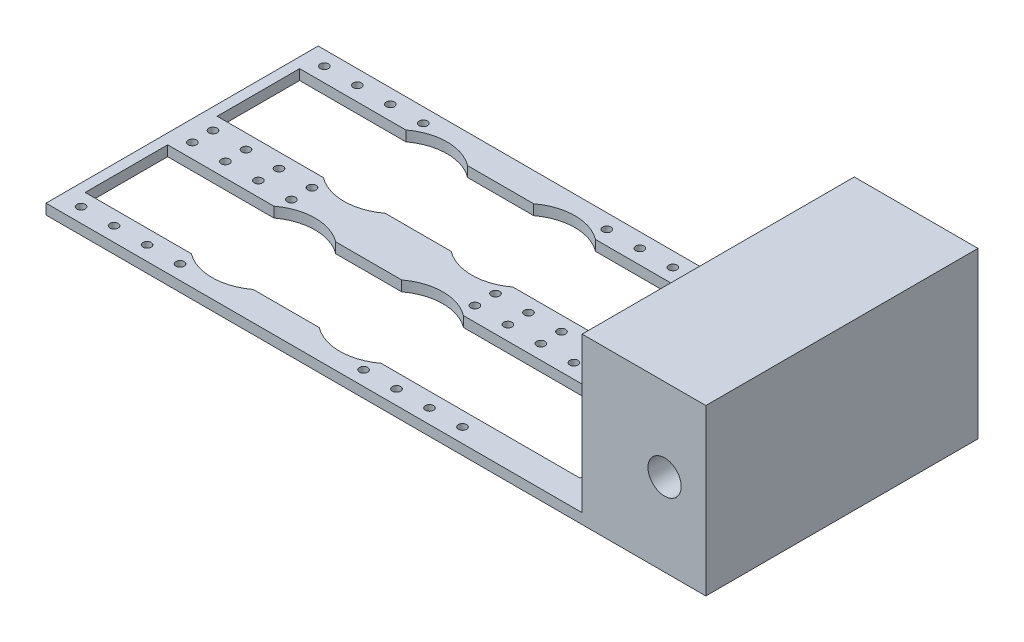
from build123d import *

# Parameters (mm, degrees)
SKETCH1_W           = 160
SKETCH1_H           = 66
BOSS_EXTRUDE1_DEPTH = 40
SKETCH2_R           = 4.025
SKETCH2_W           = 130
SKETCH2_H           = 37.5
CUT_EXTRUDE1_DEPTH  = 112.157545853
SKETCH3_R           = 1
SKETCH3_W           = 120
SKETCH3_H           = 20
CUT_EXTRUDE2_DEPTH  = 96.336247042
SKETCH4_R           = 12.5
CUT_EXTRUDE3_DEPTH  = 95.314633011


with BuildPart() as part:
    # Sketch1 → Boss-Extrude1 (new body)
    with BuildSketch(Plane(origin=(0, 0, 0), x_dir=(1, 0, 0), z_dir=(0, 1, 0))):
        Rectangle(SKETCH1_W, SKETCH1_H)
    extrude(amount=BOSS_EXTRUDE1_DEPTH)

    # Sketch2 → Cut-Extrude1 (cut, through all)
    with BuildSketch(Plane.XY.offset(33)):
        with Locations((70, 20)):
            Circle(SKETCH2_R)
        with Locations((-15, 21.25)):
            Rectangle(SKETCH2_W, SKETCH2_H)
    extrude(amount=-CUT_EXTRUDE1_DEPTH, mode=Mode.SUBTRACT)

    # Sketch3 → Cut-Extrude2 (cut, through all)
    with BuildSketch(Plane(origin=(0, 40, 0), x_dir=(1, 0, 0), z_dir=(0, 1, 0))):
        with Locations((-75, 29.5)):
            Circle(SKETCH3_R)
        with Locations((-75, 2.5)):
            Circle(SKETCH3_R)
        with Locations((-67, 29.5)):
            Circle(SKETCH3_R)
        with Locations((-59, 29.5)):
            Circle(SKETCH3_R)
        with Locations((-51, 29.5)):
            Circle(SKETCH3_R)
        with Locations((-67, 2.5)):
            Circle(SKETCH3_R)
        with Locations((-59, 2.5)):
            Circle(SKETCH3_R)
        with Locations((-51, 2.5)):
            Circle(SKETCH3_R)
        with Locations((-6.5, 29.5)):
            Circle(SKETCH3_R)
        with Locations((-6.5, 2.5)):
            Circle(SKETCH3_R)
        with Locations((1.5, 29.5)):
            Circle(SKETCH3_R)
        with Locations((9.5, 29.5)):
            Circle(SKETCH3_R)
        with Locations((17.5, 29.5)):
            Circle(SKETCH3_R)
        with Locations((1.5, 2.5)):
            Circle(SKETCH3_R)
        with Locations((9.5, 2.5)):
            Circle(SKETCH3_R)
        with Locations((17.5, 2.5)):
            Circle(SKETCH3_R)
        with Locations((17.5, -2.5)):
            Circle(SKETCH3_R)
        with Locations((9.5, -2.5)):
            Circle(SKETCH3_R)
        with Locations((1.5, -2.5)):
            Circle(SKETCH3_R)
        with Locations((17.5, -29.5)):
            Circle(SKETCH3_R)
        with Locations((9.5, -29.5)):
            Circle(SKETCH3_R)
        with Locations((1.5, -29.5)):
            Circle(SKETCH3_R)
        with Locations((-6.5, -2.5)):
            Circle(SKETCH3_R)
        with Locations((-6.5, -29.5)):
            Circle(SKETCH3_R)
        with Locations((-51, -2.5)):
            Circle(SKETCH3_R)
        with Locations((-59, -2.5)):
            Circle(SKETCH3_R)
        with Locations((-67, -2.5)):
            Circle(SKETCH3_R)
        with Locations((-51, -29.5)):
            Circle(SKETCH3_R)
        with Locations((-59, -29.5)):
            Circle(SKETCH3_R)
        with Locations((-67, -29.5)):
            Circle(SKETCH3_R)
        with Locations((-75, -2.5)):
            Circle(SKETCH3_R)
        with Locations((-75, -29.5)):
            Circle(SKETCH3_R)
        with Locations((-17.5, 16)):
            Rectangle(SKETCH3_W, SKETCH3_H)
        with Locations((-17.5, -16)):
            Rectangle(SKETCH3_W, SKETCH3_H)
    extrude(amount=-CUT_EXTRUDE2_DEPTH, mode=Mode.SUBTRACT)

    # Sketch4 → Cut-Extrude3 (cut, through all)
    with BuildSketch(Plane(origin=(0, 2.5, 0), x_dir=(1, 0, 0), z_dir=(0, 1, 0))):
        with Locations((-44.25, -16)):
            Circle(SKETCH4_R)
        with Locations((-44.25, 16)):
            Circle(SKETCH4_R)
        with Locations((-13.25, 16)):
            Circle(SKETCH4_R)
        with Locations((-13.25, -16)):
            Circle(SKETCH4_R)
    extrude(amount=-CUT_EXTRUDE3_DEPTH, mode=Mode.SUBTRACT)


solid = part.part
